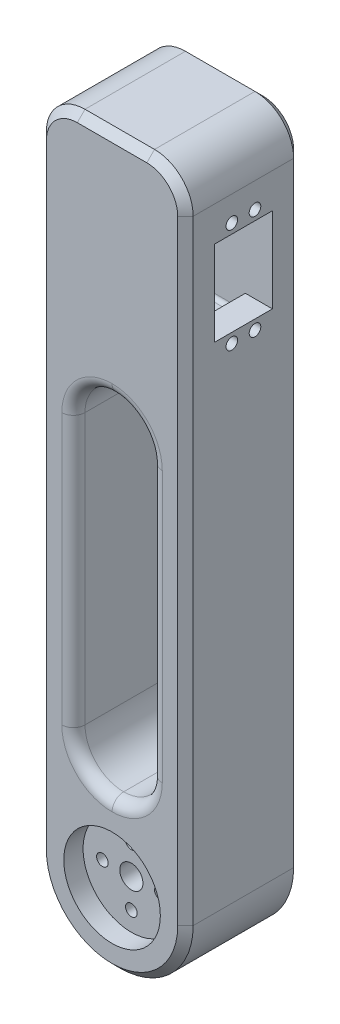
from build123d import *

# Parameters (mm, degrees)
BOSS_EXTRUDE1_DEPTH = 30
SKETCH2_R           = 12.5
CUT_EXTRUDE1_DEPTH  = 5
SKETCH3_R           = 3
SKETCH3_R_2         = 1.5
CUT_EXTRUDE3_DEPTH  = 10
SKETCH5_W           = 15
SKETCH5_H           = 32
CUT_EXTRUDE4_DEPTH  = 31
SKETCH6_R           = 1.5
SKETCH6_W           = 15
SKETCH6_H           = 22
CUT_EXTRUDE5_DEPTH  = 175.419035658
FILLET2_R           = 10
CHAMFER2_SIZE       = 2
SKETCH7_W           = 20
SKETCH7_H           = 90
CUT_EXTRUDE6_DEPTH  = 173.690474549
FILLET3_R           = 10
FILLET4_R           = 1
FILLET5_R           = 3


with BuildPart() as part:
    # Sketch1 → Boss-Extrude1 (new body)
    with BuildSketch(Plane.XY):
        with BuildLine():
            Line((19, 150), (19, 0))
            ThreePointArc((19, 0), (0, -19), (-19, 0))
            Line((-19, 0), (-19, 150))
            Line((-19, 150), (-19, 169))
            Line((-19, 169), (19, 169))
            Line((19, 169), (19, 150))
        make_face()
    extrude(amount=BOSS_EXTRUDE1_DEPTH)

    # Sketch2 → Cut-Extrude1 (cut)
    with BuildSketch(Plane.XY.offset(30)):
        Circle(SKETCH2_R)
    extrude(amount=-CUT_EXTRUDE1_DEPTH, mode=Mode.SUBTRACT)

    # Sketch3 → Cut-Extrude3 (cut)
    with BuildSketch(Plane.XY.offset(25)):
        Circle(SKETCH3_R)
        with Locations((0, 7.5)):
            Circle(SKETCH3_R_2)
        with Locations((7.5, 0)):
            Circle(SKETCH3_R_2)
        with Locations((0, -7.5)):
            Circle(SKETCH3_R_2)
        with Locations((-7.5, 0)):
            Circle(SKETCH3_R_2)
    extrude(amount=-CUT_EXTRUDE3_DEPTH, mode=Mode.SUBTRACT)

    # Sketch5 → Cut-Extrude4 (cut)
    with BuildSketch(Plane.ZY.offset(19)):
        with Locations((15, 139)):
            Rectangle(SKETCH5_W, SKETCH5_H)
    extrude(amount=-CUT_EXTRUDE4_DEPTH, mode=Mode.SUBTRACT)

    # Sketch6 → Cut-Extrude5 (cut, through all)
    with BuildSketch(Plane.ZY.offset(-12)):
        with Locations((12, 152.5)):
            Circle(SKETCH6_R)
        with Locations(Location((18, 152.5, 0), (0, 0, 180))):
            Circle(SKETCH6_R)
        with Locations((18, 125.5)):
            Circle(SKETCH6_R)
        with Locations(Location((12, 125.5, 0), (0, 0, 180))):
            Circle(SKETCH6_R)
        with Locations((15, 139)):
            Rectangle(SKETCH6_W, SKETCH6_H)
    extrude(amount=-CUT_EXTRUDE5_DEPTH, mode=Mode.SUBTRACT)

    # Fillet2
    fillet2_edges = [part.edges().sort_by_distance(p)[0] for p in [
        (-19, 169, 15),
        (19, 169, 15),
    ]]
    fillet(fillet2_edges, radius=FILLET2_R)

    # Chamfer2
    chamfer2_edges = [part.edges().sort_by_distance(p)[0] for p in [
        (16.071067812, 166.071067812, 30),
        (0, -19, 30),
        (19, 79.5, 30),
        (19, 79.5, 0),
        (0, -19, 0),
        (0, 169, 0),
        (0, 169, 30),
        (-19, 79.5, 0),
        (-16.071067812, 166.071067812, 0),
        (16.071067812, 166.071067812, 0),
        (-19, 79.5, 30),
        (-16.071067812, 166.071067812, 30),
    ]]
    chamfer(chamfer2_edges, length=CHAMFER2_SIZE)

    # Sketch7 → Cut-Extrude6 (cut, through all)
    with BuildSketch(Plane(origin=(0, 0, 0), x_dir=(-1, 0, 0), z_dir=(0, 0, -1))):
        with Locations((0, 65)):
            Rectangle(SKETCH7_W, SKETCH7_H)
    extrude(amount=-CUT_EXTRUDE6_DEPTH, mode=Mode.SUBTRACT)

    # Fillet3
    fillet3_edges = [part.edges().sort_by_distance(p)[0] for p in [
        (-10, 110, 15),
        (10, 20, 15),
        (-10, 20, 15),
        (10, 110, 15),
    ]]
    fillet(fillet3_edges, radius=FILLET3_R - 0.0001)  # a hair under: the kernel refuses the full size

    # Fillet4
    fillet4_edges = [part.edges().sort_by_distance(p)[0] for p in [
        (-3.5, 155, 22.5),
        (-3.5, 123, 22.5),
        (-3.5, 123, 7.5),
        (-3.5, 155, 7.5),
    ]]
    fillet(fillet4_edges, radius=FILLET4_R)

    # Fillet5
    fillet5_edges = [part.edges().sort_by_distance(p)[0] for p in [
        (-10, 65, 0),
        (-10, 65, 30),
        (10, 65, 0),
        (10, 65, 30),
        (-7.071097101, 107.071097101, 0),
        (-7.071097101, 107.071097101, 30),
        (7.071097101, 22.928902899, 0),
        (7.071097101, 22.928902899, 30),
        (-7.071097101, 22.928902899, 0),
        (-7.071097101, 22.928902899, 30),
        (7.071097101, 107.071097101, 0),
        (7.071097101, 107.071097101, 30),
    ]]
    fillet(fillet5_edges, radius=FILLET5_R)


solid = part.part
